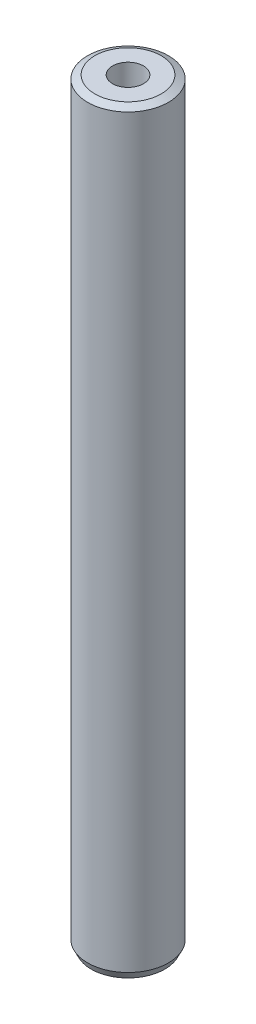
from build123d import *
from OCP.BRepFilletAPI import BRepFilletAPI_MakeChamfer

# Parameters (mm, degrees)
SKETCH1_R           = 22.5
BOSS_EXTRUDE1_DEPTH = 420.642684443
SKETCH2_R           = 8.604745809
CUT_EXTRUDE1_DEPTH  = 422.844483163
CHAMFER1_SIZE       = 2.018223807
CHAMFER1_SIZE2      = 4.059661866


with BuildPart() as part:
    # Sketch1 → Boss-Extrude1 (new body)
    with BuildSketch(Plane(origin=(0, 0, 0), x_dir=(1, 0, 0), z_dir=(0, 1, 0))):
        Circle(SKETCH1_R)
    extrude(amount=BOSS_EXTRUDE1_DEPTH)

    # Sketch2 → Cut-Extrude1 (cut, through all)
    with BuildSketch(Plane(origin=(0, 0, 0), x_dir=(1, 0, 0), z_dir=(0, 1, 0))):
        Circle(SKETCH2_R)
    extrude(amount=CUT_EXTRUDE1_DEPTH, mode=Mode.SUBTRACT)

    # Chamfer1: one chamfer whose edges measure the first distance from different faces: ONE call of the kernel's chamfer builder (chamfer() names one face for all edges)
    chamfer1_edges_1 = [part.edges().sort_by_distance(p)[0] for p in [
        (-22.5, 420.642684443, 0),
    ]]
    chamfer1_side_1 = [part.faces().sort_by_distance(p)[0] for p in [
        (-22.5, 210.321342221, 0),
    ]]
    chamfer1_edges_2 = [part.edges().sort_by_distance(p)[0] for p in [
        (-22.5, 0, 0),
    ]]
    chamfer1_side_2 = [part.faces().sort_by_distance(p)[0] for p in [
        (-21.863603897, 0, 0),
    ]]
    chamfer1 = BRepFilletAPI_MakeChamfer(part.part.solid().wrapped)
    for e in chamfer1_edges_1:
        chamfer1.Add(CHAMFER1_SIZE, CHAMFER1_SIZE2, e.wrapped, chamfer1_side_1[0].wrapped)  # the first distance lies on this face
    for e in chamfer1_edges_2:
        chamfer1.Add(CHAMFER1_SIZE, CHAMFER1_SIZE2, e.wrapped, chamfer1_side_2[0].wrapped)  # the first distance lies on this face
    add(Compound.cast(chamfer1.Shape()), mode=Mode.REPLACE)


solid = part.part
